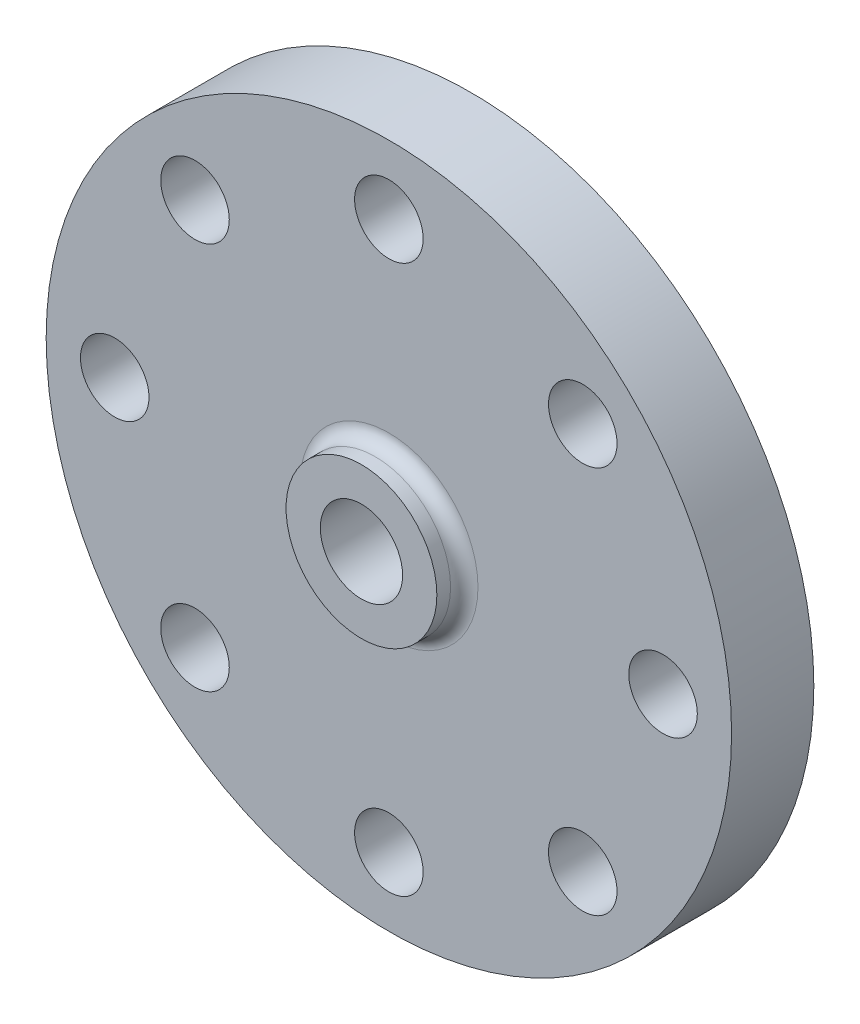
from build123d import *

# Parameters (mm, degrees)
SKETCH1_R           = 12.5
SKETCH1_R_2         = 1.25
SKETCH1_R_3         = 1.5
BOSS_EXTRUDE1_DEPTH = 3
SKETCH2_R           = 2.75
SKETCH2_R_2         = 1.5
BOSS_EXTRUDE2_DEPTH = 1
FILLET1_R           = 0.5
SKETCH3_R           = 3.5
SKETCH3_R_2         = 1.5
CUT_EXTRUDE1_DEPTH  = 0.5


with BuildPart() as part:
    # Sketch1 → Boss-Extrude1 (new body)
    with BuildSketch(Plane.XY):
        Circle(SKETCH1_R)
        with Locations((0, 10)):
            Circle(SKETCH1_R_2, mode=Mode.SUBTRACT)
        Circle(SKETCH1_R_3, mode=Mode.SUBTRACT)
        with Locations((7.071067812, 7.071067812)):
            Circle(SKETCH1_R_2, mode=Mode.SUBTRACT)
        with Locations((10, 0)):
            Circle(SKETCH1_R_2, mode=Mode.SUBTRACT)
        with Locations((7.071067812, -7.071067812)):
            Circle(SKETCH1_R_2, mode=Mode.SUBTRACT)
        with Locations((0, -10)):
            Circle(SKETCH1_R_2, mode=Mode.SUBTRACT)
        with Locations((-7.071067812, -7.071067812)):
            Circle(SKETCH1_R_2, mode=Mode.SUBTRACT)
        with Locations((-10, 0)):
            Circle(SKETCH1_R_2, mode=Mode.SUBTRACT)
        with Locations((-7.071067812, 7.071067812)):
            Circle(SKETCH1_R_2, mode=Mode.SUBTRACT)
    extrude(amount=BOSS_EXTRUDE1_DEPTH)

    # Sketch2 → Boss-Extrude2 (add)
    with BuildSketch(Plane.XY.offset(3)):
        Circle(SKETCH2_R)
        Circle(SKETCH2_R_2, mode=Mode.SUBTRACT)
    extrude(amount=BOSS_EXTRUDE2_DEPTH)

    # Fillet1
    fillet1_edges = [part.edges().sort_by_distance(p)[0] for p in [
        (-2.75, 0, 3),
    ]]
    fillet(fillet1_edges, radius=FILLET1_R)

    # Sketch3 → Cut-Extrude1 (cut)
    with BuildSketch(Plane(origin=(0, 0, 0), x_dir=(-1, 0, 0), z_dir=(0, 0, -1))):
        Circle(SKETCH3_R)
        Circle(SKETCH3_R_2, mode=Mode.SUBTRACT)
    extrude(amount=-CUT_EXTRUDE1_DEPTH, mode=Mode.SUBTRACT)


solid = part.part
